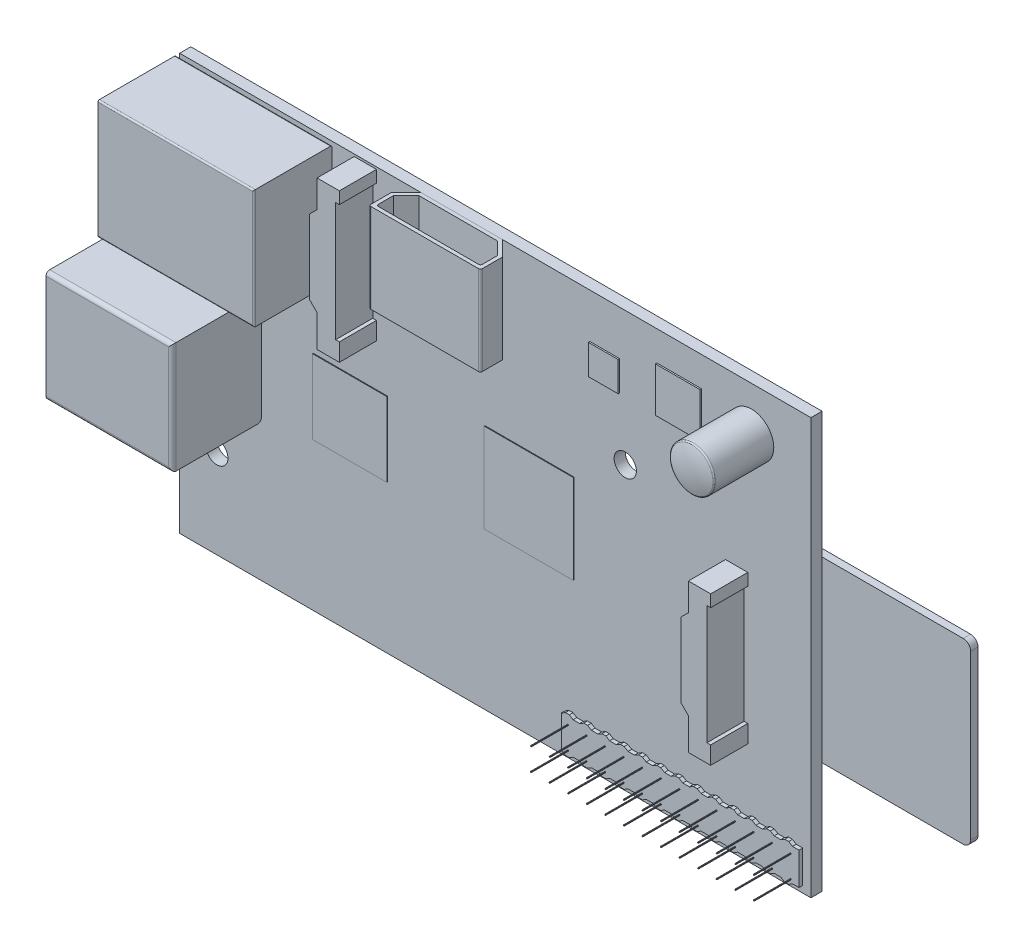
from build123d import *

# Parameters (mm, degrees)
SKETCH1_W              = 85
SKETCH1_H              = 56
BOSS_EXTRUDE1_DEPTH    = 1.5
SKETCH3_W              = 32
SKETCH3_H              = 5
BOSS_EXTRUDE2_DEPTH    = 0.5
CUT_EXTRUDE1_DEPTH     = 0.5
SKETCH5_W              = 0.1
SKETCH5_H              = 0.1
BOSS_EXTRUDE3_DEPTH    = 5
LPATTERN1_COUNT        = 2
LPATTERN1_PITCH        = 3
LPATTERN1_COUNT_DIR2   = 13
LPATTERN1_PITCH_DIR2   = 2.5
SKETCH6_W              = 10
SKETCH6_H              = 10
BOSS_EXTRUDE4_DEPTH    = 13.5
SKETCH7_R              = 4
SKETCH7_R_2            = 1
EXTRUDE_THIN1_DEPTH    = 10
FILLET1_R              = 0.2
SKETCH8_W              = 12
SKETCH8_H              = 10
BOSS_EXTRUDE5_DEPTH    = 8
SKETCH9_R              = 2.5
BOSS_EXTRUDE6_DEPTH    = 6
SKETCH11_W             = 17
SKETCH11_H             = 15
BOSS_EXTRUDE7_DEPTH    = 12
SHELL1_T               = -0.5
FILLET3_R              = 0.5
FILLET4_R              = 0.25
SKETCH13_W             = 2
SKETCH13_H             = 13.8
BOSS_EXTRUDE8_DEPTH    = 16.5
SKETCH14_W             = 1
SKETCH14_H             = 13
BOSS_EXTRUDE9_DEPTH    = 16.5
FILLET5_R              = 0.1
LPATTERN2_COUNT        = 2
LPATTERN2_PITCH        = 6.5
CHAMFER1_SIZE          = 0.1
SKETCH15_W             = 21
SKETCH15_H             = 16
BOSS_EXTRUDE10_DEPTH   = 10.5
CUT_EXTRUDE3_DEPTH     = 20
SKETCH17_R             = 2
CUT_EXTRUDE4_DEPTH     = 6
BOSS_EXTRUDE11_DEPTH   = 5
FILLET7_R              = 0.2
BOSS_EXTRUDE12_DEPTH   = 12
SHELL3_T               = -0.5
SKETCH20_W             = 12
SKETCH20_H             = 0.2
BOSS_EXTRUDE14_DEPTH   = 8
FILLET8_R              = 0.25
LPATTERN3_COUNT        = 2
LPATTERN3_PITCH        = 50
LPATTERN3_COUNT_DIR2   = 2
LPATTERN3_PITCH_DIR2   = 22
SKETCH21_W             = 10
SKETCH21_H             = 10
BOSS_EXTRUDE15_DEPTH   = 0.1
SKETCH21_W_2           = 12
SKETCH21_H_2           = 12
BOSS_EXTRUDE15_2_DEPTH = 0.1
SKETCH22_W             = 4
SKETCH22_H             = 4
BOSS_EXTRUDE16_DEPTH   = 0.2
SKETCH22_W_2           = 6
SKETCH22_H_2           = 6
BOSS_EXTRUDE16_2_DEPTH = 0.2
SKETCH23_R             = 3
BOSS_EXTRUDE17_DEPTH   = 8
DOME1_FACE_RADIUS      = 3
DOME1_HEIGHT           = 0.5
FILLET9_R              = 0.2
BOSS_EXTRUDE18_DEPTH   = 1
WRAP1_START            = -0.2
WRAP1_DEPTH            = 0.2
FILLET10_R             = 1
SKETCH26_W             = 24.304893939
SKETCH26_H             = 23.775245325
CUT_EXTRUDE5_DEPTH     = 31
SKETCH27_R             = 1.5
CUT_EXTRUDE6_DEPTH     = 10


# Read off the part's stored shape, not the designer's step: Wrap1
with BuildPart() as part:
    # Sketch1 → Boss-Extrude1 (new body)
    with BuildSketch(Plane.XY):
        with Locations((42.5, 28)):
            Rectangle(SKETCH1_W, SKETCH1_H)
    extrude(amount=BOSS_EXTRUDE1_DEPTH)


with BuildPart() as body_2:
    # Sketch3 → Boss-Extrude2 (new body)
    with BuildSketch(Plane.XY.offset(1.5)):
        with Locations((67.894973725, 3.074558463)):
            Rectangle(SKETCH3_W, SKETCH3_H)
    extrude(amount=BOSS_EXTRUDE2_DEPTH)

    # Sketch4 → Cut-Extrude1 (cut)
    with BuildSketch(Plane.XY.offset(2)):
        Polygon((83.894973725, 5.574558463), (82.504308399, 5.574558463), (83.018067155, 5.258509186), (83.894973725, 5.258509186), align=None)
        Polygon((81.990441556, 5.574558463), (80.042769937, 5.574558463), (80.556528693, 5.258509186), (81.433435263, 5.258509186), align=None)
        Polygon((79.528903094, 5.574558463), (77.581231476, 5.574558463), (78.094990232, 5.258509186), (78.971896802, 5.258509186), align=None)
        Polygon((77.067364632, 5.574558463), (75.119693014, 5.574558463), (75.63345177, 5.258509186), (76.51035834, 5.258509186), align=None)
        Polygon((74.605826171, 5.574558463), (72.658154553, 5.574558463), (73.171913309, 5.258509186), (74.048819879, 5.258509186), align=None)
        Polygon((72.144287709, 5.574558463), (70.196616091, 5.574558463), (70.710374847, 5.258509186), (71.587281417, 5.258509186), align=None)
        Polygon((51.894973725, 5.574558463), (51.894973725, 5.258509186), (52.451980017, 5.574558463), align=None)
        Polygon((54.913518479, 5.574558463), (52.96584686, 5.574558463), (53.479605617, 5.258509186), (54.356512186, 5.258509186), align=None)
        Polygon((57.37505694, 5.574558463), (55.427385322, 5.574558463), (55.941144078, 5.258509186), (56.818050648, 5.258509186), align=None)
        Polygon((59.836595402, 5.574558463), (57.888923784, 5.574558463), (58.40268254, 5.258509186), (59.27958911, 5.258509186), align=None)
        Polygon((62.298133863, 5.574558463), (60.350462245, 5.574558463), (60.864221001, 5.258509186), (61.741127571, 5.258509186), align=None)
        Polygon((64.759672325, 5.574558463), (62.812000707, 5.574558463), (63.325759463, 5.258509186), (64.202666033, 5.258509186), align=None)
        Polygon((67.221210786, 5.574558463), (65.273539168, 5.574558463), (65.787297924, 5.258509186), (66.664204494, 5.258509186), align=None)
        Polygon((69.682749248, 5.574558463), (67.73507763, 5.574558463), (68.248836386, 5.258509186), (69.125742956, 5.258509186), align=None)
    cut_extrude1 = extrude(amount=-CUT_EXTRUDE1_DEPTH, mode=Mode.SUBTRACT)

    # Mirror2: Cut-Extrude1 across plane
    add(cut_extrude1.mirror(Plane(origin=(0, 3.074558463, 0), x_dir=(0, 0, 1), z_dir=(0, -1, 0))), mode=Mode.SUBTRACT)

    # Sketch5 → Boss-Extrude3 (add)
    with BuildSketch(Plane.XY.offset(2)):
        with Locations((52.802606205, 4.32872358)):
            Rectangle(SKETCH5_W, SKETCH5_H)
    boss_extrude3 = extrude(amount=BOSS_EXTRUDE3_DEPTH)

    # LPattern1: Boss-Extrude3 2 × 13
    with Locations(*[(j * LPATTERN1_PITCH_DIR2, -i * LPATTERN1_PITCH, 0) for i in range(LPATTERN1_COUNT) for j in range(LPATTERN1_COUNT_DIR2) if (i, j) != (0, 0)]):
        add(boss_extrude3)


with BuildPart() as body_3:
    # Sketch6 → Boss-Extrude4 (new body)
    with BuildSketch(Plane.XY.offset(1.5)):
        with Locations((42.667890961, 5.5)):
            Rectangle(SKETCH6_W, SKETCH6_H)
    extrude(amount=BOSS_EXTRUDE4_DEPTH)

    # Sketch7 → Extrude-Thin1 (add)
    with BuildSketch(Plane.XZ.offset(-0.5)):
        with Locations((42.667890961, 10)):
            Circle(SKETCH7_R)
        with Locations((42.667890961, 10)):
            Circle(SKETCH7_R_2, mode=Mode.SUBTRACT)
    extrude(amount=EXTRUDE_THIN1_DEPTH)

    # Fillet1
    fillet1_edges = [body_3.edges().sort_by_distance(p)[0] for p in [
        (38.667890961, 0.5, 10),
        (38.667890961, -9.5, 10),
    ]]
    fillet(fillet1_edges, radius=FILLET1_R)


with BuildPart() as body_4:
    # Sketch8 → Boss-Extrude5 (new body)
    with BuildSketch(Plane.XY.offset(1.5)):
        with Locations((24.989350191, 5.5)):
            Rectangle(SKETCH8_W, SKETCH8_H)
    extrude(amount=BOSS_EXTRUDE5_DEPTH)


with BuildPart() as body_5:
    # Sketch9 → Boss-Extrude6 (new body)
    with BuildSketch(Plane.XZ.offset(-0.5)):
        with Locations(Location((24.989350191, 6.5, 0), (0, 0, 270))):
            Circle(SKETCH9_R)
    extrude(amount=BOSS_EXTRUDE6_DEPTH)

    # Sketch17 → Cut-Extrude4 (cut)
    with BuildSketch(Plane.XZ.offset(5.5)):
        with Locations(Location((24.989350191, 6.5, 0), (0, 0, 270))):
            Circle(SKETCH17_R)
    extrude(amount=-CUT_EXTRUDE4_DEPTH, mode=Mode.SUBTRACT)


with BuildPart() as body_6:
    # Sketch11 → Boss-Extrude7 (new body)
    with BuildSketch(Plane.XY.offset(1.5)):
        with Locations((2.5, 26)):
            Rectangle(SKETCH11_W, SKETCH11_H)
    extrude(amount=BOSS_EXTRUDE7_DEPTH)

    # Shell1
    shell1_openings = [body_6.faces().sort_by_distance(p)[0] for p in [
        (-6, 26, 7.5),
    ]]
    offset(amount=SHELL1_T, openings=shell1_openings, kind=Kind.INTERSECTION)

    # Fillet3
    fillet3_edges = [body_6.edges().sort_by_distance(p)[0] for p in [
        (11, 26, 13.5),
        (2.5, 33.5, 13.5),
        (2.5, 33.5, 1.5),
        (2.5, 18.5, 1.5),
        (2.5, 18.5, 13.5),
    ]]
    fillet(fillet3_edges, radius=FILLET3_R)

    # Fillet4
    fillet4_edges = [body_6.edges().sort_by_distance(p)[0] for p in [
        (2.25, 19, 2),
        (2.25, 33, 2),
        (2.25, 19, 13),
        (2.25, 33, 13),
    ]]
    fillet(fillet4_edges, radius=FILLET4_R)

    # Sketch13 → Boss-Extrude8 (add)
    with BuildSketch(Plane.ZY.offset(6)):
        with Locations((7.5, 26)):
            Rectangle(SKETCH13_W, SKETCH13_H)
    extrude(amount=-BOSS_EXTRUDE8_DEPTH)

    # Sketch14 → Boss-Extrude9 (add)
    with BuildSketch(Plane.ZY.offset(6)):
        with Locations((11, 26)):
            Rectangle(SKETCH14_W, SKETCH14_H)
    boss_extrude9 = extrude(amount=-BOSS_EXTRUDE9_DEPTH)

    # Fillet5
    fillet5_edges = [body_6.edges().sort_by_distance(p)[0] for p in [
        (-6, 26, 6.5),
        (-6, 26, 8.5),
    ]]
    fillet(fillet5_edges, radius=FILLET5_R)

    # LPattern2: Boss-Extrude9 ×2
    with Locations(*[(0, 0, -i * LPATTERN2_PITCH) for i in range(1, LPATTERN2_COUNT)]):
        add(boss_extrude9)

    # Chamfer1
    chamfer1_edges = [body_6.edges().sort_by_distance(p)[0] for p in [
        (-6, 19.5, 4.5),
        (-6, 32.5, 4.5),
        (-6, 19.5, 11),
        (-6, 32.5, 11),
    ]]
    chamfer(chamfer1_edges, length=CHAMFER1_SIZE)


with BuildPart() as body_7:
    # Sketch15 → Boss-Extrude10 (new body)
    with BuildSketch(Plane.XY.offset(1.5)):
        with Locations((10, 47.5)):
            Rectangle(SKETCH15_W, SKETCH15_H)
    extrude(amount=BOSS_EXTRUDE10_DEPTH)

    # Sketch16 → Cut-Extrude3 (cut)
    with BuildSketch(Plane.ZY.offset(0.5)):
        Polygon((11.2, 54.7), (4.2, 54.7), (4.2, 50.697953924), (3.2, 50.697953924), (3.2, 49.697953924), (1.637903555, 49.697953924), (1.637903555, 45.302046076), (3.2, 45.302046076), (3.2, 44.302046076), (4.2, 44.302046076), (4.2, 40.3), (11.2, 40.3), align=None)
    extrude(amount=-CUT_EXTRUDE3_DEPTH, mode=Mode.SUBTRACT)

    # Fillet7
    fillet7_edges = [body_7.edges().sort_by_distance(p)[0] for p in [
        (20.5, 47.5, 12),
        (10, 55.5, 12),
        (10, 55.5, 1.5),
        (10, 39.5, 1.5),
        (10, 39.5, 12),
    ]]
    fillet(fillet7_edges, radius=FILLET7_R)


with BuildPart() as body_8:
    # Sketch18 → Boss-Extrude11 (new body)
    with BuildSketch(Plane.XY.offset(1.5)):
        Polygon((23.5, 52), (22.5, 51), (22.5, 41), (23.5, 40), (23.5, 35.7), (26.5, 35.7), (26.5, 38.08552574), (26, 38.08552574), (26, 54.08552574), (26.5, 54.08552574), (26.5, 55.7), (23.5, 55.7), align=None)
    boss_extrude11 = extrude(amount=BOSS_EXTRUDE11_DEPTH)


with BuildPart() as body_9:
    # Sketch19 → Boss-Extrude12 (new body)
    with BuildSketch(Plane(origin=(0, 56, 0), x_dir=(1, 0, 0), z_dir=(0, 1, 0))):
        Polygon((45.5, -6.5), (30.5, -6.5), (30.5, -3.5), (32.5, -1.5), (43.5, -1.5), (45.5, -3.5), align=None)
    extrude(amount=-BOSS_EXTRUDE12_DEPTH)

    # Shell3
    shell3_openings = [body_9.faces().sort_by_distance(p)[0] for p in [
        (38, 56, 4.103286385),
    ]]
    offset(amount=SHELL3_T, openings=shell3_openings, kind=Kind.INTERSECTION)

    # Sketch20 → Boss-Extrude14 (add)
    with BuildSketch(Plane(origin=(0, 44.5, 0), x_dir=(1, 0, 0), z_dir=(0, 1, 0))):
        with Locations((38, -3.9)):
            Rectangle(SKETCH20_W, SKETCH20_H)
    extrude(amount=BOSS_EXTRUDE14_DEPTH)

    # Fillet8
    fillet8_edges = [body_9.edges().sort_by_distance(p)[0] for p in [
        (45.5, 50, 6.5),
        (30.5, 50, 6.5),
        (45, 50.25, 6),
        (31, 50.25, 6),
    ]]
    fillet(fillet8_edges, radius=FILLET8_R)


with BuildPart() as part_1:
    add(part.part)

    # LPattern3: Boss-Extrude11 2 × 2, 2 skipped
    with Locations(*[(i * LPATTERN3_PITCH, -j * LPATTERN3_PITCH_DIR2, 0) for i in range(LPATTERN3_COUNT) for j in range(LPATTERN3_COUNT_DIR2) if (i, j) not in ((0, 0), (0, 1), (1, 0))]):
        add(boss_extrude11)

    # Sketch27 → Cut-Extrude6 (cut)
    with BuildSketch(Plane.XY.offset(1.5)):
        with Locations((60, 38)):
            Circle(SKETCH27_R)
        with Locations((5, 12)):
            Circle(SKETCH27_R)
    extrude(amount=-CUT_EXTRUDE6_DEPTH, mode=Mode.SUBTRACT)


with BuildPart() as body_10:
    # Sketch21 → Boss-Extrude15 (new body)
    with BuildSketch(Plane.XY.offset(1.5)):
        with Locations((23, 25)):
            Rectangle(SKETCH21_W, SKETCH21_H)
    extrude(amount=BOSS_EXTRUDE15_DEPTH)


with BuildPart() as body_11:
    # Sketch21 → Boss-Extrude15 2 (new body)
    with BuildSketch(Plane.XY.offset(1.5)):
        with Locations((47.107501829, 27.116628368)):
            Rectangle(SKETCH21_W_2, SKETCH21_H_2)
    extrude(amount=BOSS_EXTRUDE15_2_DEPTH)


with BuildPart() as body_12:
    # Sketch22 → Boss-Extrude16 (new body)
    with BuildSketch(Plane.XY.offset(1.5)):
        with Locations((57.25, 48)):
            Rectangle(SKETCH22_W, SKETCH22_H)
    extrude(amount=BOSS_EXTRUDE16_DEPTH)


with BuildPart() as body_13:
    # Sketch22 → Boss-Extrude16 2 (new body)
    with BuildSketch(Plane.XY.offset(1.5)):
        with Locations((67.25, 49)):
            Rectangle(SKETCH22_W_2, SKETCH22_H_2)
    extrude(amount=BOSS_EXTRUDE16_2_DEPTH)


with BuildPart() as body_14:
    # Sketch23 → Boss-Extrude17 (new body)
    with BuildSketch(Plane.XY.offset(1.5)):
        with Locations((77, 50)):
            Circle(SKETCH23_R)
    extrude(amount=BOSS_EXTRUDE17_DEPTH)

    # Dome1: a dome of height H over a round flat face of radius A is a cap of a sphere of radius (A * A + H * H) / (2 * H)
    dome1_r = (DOME1_FACE_RADIUS * DOME1_FACE_RADIUS + DOME1_HEIGHT * DOME1_HEIGHT) / (2 * DOME1_HEIGHT)
    dome1_base = Plane((77, 50, 9.5), z_dir=(0, 0, 1))
    with Locations(dome1_base.offset(DOME1_HEIGHT - dome1_r)):
        dome1_ball = Sphere(dome1_r, mode=Mode.PRIVATE)
    add(split(dome1_ball, bisect_by=dome1_base, keep=Keep.TOP, mode=Mode.PRIVATE))

    # Fillet9
    fillet9_edges = [body_14.edges().sort_by_distance(p)[0] for p in [
        (74, 50, 9.5),
    ]]
    fillet(fillet9_edges, radius=FILLET9_R)


with BuildPart() as body_15:
    # Sketch24 → Boss-Extrude18 (new body)
    with BuildSketch(Plane(origin=(0, 0, 0), x_dir=(-1, 0, 0), z_dir=(0, 0, -1))):
        Polygon((-73.642978125, 15), (-105, 15), (-105, 39), (-70, 39), (-70, 18.642978125), align=None)
    extrude(amount=BOSS_EXTRUDE18_DEPTH)

    # Wrap1 outline → Wrap1 (cut)
    # profile 1 of 4: a face of its own
    with BuildSketch(Plane(origin=(0, 0, -1), x_dir=(-1, 0, 0), z_dir=(0, 0, -1)).offset(WRAP1_START)):
        with BuildLine():
            add(Edge.make_bspline(
                [(-97.099984972, 19.704636475), (-97.099910305, 19.678525069), (-97.099766943, 19.62839032), (-97.096542146, 19.556085612), (-97.091273316, 19.489806079), (-97.083222568, 19.429667638), (-97.073976835, 19.375446348), (-97.062457247, 19.327199246), (-97.047933819, 19.285021981), (-97.028085519, 19.23734358), (-96.993540547, 19.187438021), (-96.935887295, 19.146201074), (-96.866742985, 19.119130925), (-96.815985111, 19.117103867), (-96.789067251, 19.11602888)],
                knots=[0, 0, 0, 0, 0.103577828, 0.198872802, 0.287057146, 0.36725271, 0.439492683, 0.505211235, 0.563769695, 0.616246184, 0.71001282, 0.799777886, 0.89381843, 1, 1, 1, 1], degree=3))
            Line((-97.099984972, 19.704636475), (-97.099984972, 20.078054196))
            Line((-97.099984972, 20.078054196), (-97.606314086, 20.078054196))
            Line((-97.606314086, 20.078054196), (-97.606314086, 18.660332677))
            Line((-97.606314086, 18.660332677), (-97.099984972, 18.660332677))
            Line((-97.099984972, 18.660332677), (-97.099984972, 18.806693437))
            add(Edge.make_bspline(
                [(-96.661693833, 18.609699766), (-96.682569177, 18.610268806), (-96.723749914, 18.611391351), (-96.784110146, 18.621469921), (-96.842334794, 18.636184305), (-96.898250514, 18.657944328), (-96.952265725, 18.685883536), (-97.004530951, 18.719680102), (-97.053804717, 18.760666258), (-97.084394151, 18.791154295), (-97.099984972, 18.806693437)],
                knots=[0, 0, 0, 0, 0.126464108, 0.249475423, 0.370073488, 0.490023371, 0.612294809, 0.738232318, 0.866582257, 1, 1, 1, 1], degree=3))
            add(Edge.make_bspline(
                [(-95.93542801, 19.566187108), (-95.936024529, 19.532411338), (-95.93719207, 19.466303468), (-95.946678778, 19.36919163), (-95.963331417, 19.276660971), (-95.986157757, 19.188507108), (-96.015642921, 19.10491992), (-96.051131553, 19.025660923), (-96.093370254, 18.95062494), (-96.141863652, 18.880957774), (-96.195548847, 18.817785651), (-96.252404943, 18.762309837), (-96.312150955, 18.714610762), (-96.376028094, 18.676728022), (-96.442718976, 18.646149937), (-96.51295212, 18.624833705), (-96.5863035, 18.611704651), (-96.636321855, 18.610374493), (-96.661693833, 18.609699766)],
                knots=[0, 0, 0, 0, 0.075798931, 0.148358008, 0.218715806, 0.286620861, 0.352515017, 0.417420846, 0.481292903, 0.545493213, 0.607638867, 0.667075962, 0.723557301, 0.778777834, 0.833347415, 0.887830258, 0.943101523, 1, 1, 1, 1], degree=3))
            add(Edge.make_bspline(
                [(-96.524826744, 20.891345336), (-96.477887069, 20.834468788), (-96.386832552, 20.72413853), (-96.267054918, 20.553159526), (-96.165070381, 20.384466054), (-96.081401738, 20.217479026), (-96.016559798, 20.051979027), (-95.970523398, 19.888515167), (-95.941218381, 19.726781796), (-95.93734343, 19.619310859), (-95.93542801, 19.566187108)],
                knots=[0, 0, 0, 0, 0.149409612, 0.289827739, 0.422642351, 0.548605415, 0.667905425, 0.782285286, 0.892381861, 1, 1, 1, 1], degree=3))
            Line((-96.524826744, 20.891345336), (-96.785111554, 21.195933943))
            add(Edge.make_bspline(
                [(-97.099984972, 21.91824407), (-97.099263456, 21.890508264), (-97.097806134, 21.834487376), (-97.08444622, 21.74995042), (-97.062773097, 21.664620448), (-97.033517837, 21.576702933), (-96.991582007, 21.486558501), (-96.93616279, 21.3927901), (-96.867012765, 21.294461375), (-96.813290604, 21.229833435), (-96.785111554, 21.195933943)],
                knots=[0, 0, 0, 0, 0.103217746, 0.208479606, 0.31779, 0.430816732, 0.552957457, 0.687178245, 0.835914644, 1, 1, 1, 1], degree=3))
            add(Edge.make_bspline(
                [(-96.8626432, 22.204636475), (-96.881198823, 22.203778796), (-96.916479216, 22.202148065), (-96.965860998, 22.188463542), (-97.008240209, 22.166263748), (-97.042743058, 22.133982687), (-97.069322982, 22.092431386), (-97.086735635, 22.04170859), (-97.09801307, 21.982818603), (-97.099298607, 21.940720682), (-97.099984972, 21.91824407)],
                knots=[0, 0, 0, 0, 0.130772075, 0.248641082, 0.358570943, 0.465253919, 0.578322157, 0.703157386, 0.841511979, 1, 1, 1, 1], degree=3))
            add(Edge.make_bspline(
                [(-96.593655858, 21.742611158), (-96.594322873, 21.780617084), (-96.595563504, 21.851307216), (-96.606680604, 21.949056358), (-96.626445282, 22.030073221), (-96.654924756, 22.094835335), (-96.692276904, 22.145368255), (-96.740589402, 22.180428748), (-96.798881292, 22.200886485), (-96.840582755, 22.203339047), (-96.8626432, 22.204636475)],
                knots=[0, 0, 0, 0, 0.188217165, 0.350079523, 0.486314825, 0.599720386, 0.698480414, 0.793847541, 0.890943518, 1, 1, 1, 1], degree=3))
            Line((-96.593655858, 21.742611158), (-96.593655858, 21.445142804))
            Line((-96.593655858, 21.445142804), (-96.087326744, 21.445142804))
            Line((-96.087326744, 21.445142804), (-96.087326744, 22.660332677))
            Line((-96.087326744, 22.660332677), (-96.593655858, 22.660332677))
            Line((-96.593655858, 22.660332677), (-96.593655858, 22.531376981))
            add(Edge.make_bspline(
                [(-97.00900396, 22.710965589), (-96.989468466, 22.710233829), (-96.951032054, 22.708794079), (-96.894156351, 22.70106297), (-96.839362972, 22.686505672), (-96.786103395, 22.666635343), (-96.734556256, 22.641381225), (-96.685260317, 22.610002604), (-96.637492012, 22.573853209), (-96.608408736, 22.545672182), (-96.593655858, 22.531376981)],
                knots=[0, 0, 0, 0, 0.126084722, 0.248073816, 0.369396688, 0.491065023, 0.614328805, 0.738947174, 0.867577483, 1, 1, 1, 1], degree=3))
            add(Edge.make_bspline(
                [(-97.656946997, 21.825680779), (-97.656215021, 21.857339546), (-97.654779311, 21.91943555), (-97.647195506, 22.01043778), (-97.633027555, 22.097246556), (-97.612189307, 22.179308865), (-97.587146144, 22.257259499), (-97.556165499, 22.330741147), (-97.518883095, 22.399481937), (-97.476546106, 22.463570751), (-97.429002128, 22.520746852), (-97.379348821, 22.572394546), (-97.325266534, 22.614912743), (-97.268521357, 22.650594982), (-97.208002211, 22.67757656), (-97.14434882, 22.696231683), (-97.077804024, 22.708917772), (-97.032271457, 22.710273037), (-97.00900396, 22.710965589)],
                knots=[0, 0, 0, 0, 0.077644879, 0.152293886, 0.223736827, 0.293061565, 0.359729377, 0.424349007, 0.48829531, 0.551249679, 0.612356802, 0.670432256, 0.726585662, 0.780601957, 0.834443774, 0.888456198, 0.943000245, 1, 1, 1, 1], degree=3))
            add(Edge.make_bspline(
                [(-97.097611554, 20.61602888), (-97.124582735, 20.648139915), (-97.176877038, 20.710399857), (-97.251461957, 20.80162019), (-97.317740123, 20.889220242), (-97.378327863, 20.970844058), (-97.430302729, 21.048954115), (-97.476772211, 21.121136922), (-97.514566137, 21.189683352), (-97.557749177, 21.274310273), (-97.598270754, 21.383445764), (-97.632192048, 21.521753928), (-97.652988508, 21.670254174), (-97.655601963, 21.772869191), (-97.656946997, 21.825680779)],
                knots=[0, 0, 0, 0, 0.091930007, 0.17824268, 0.258254189, 0.332718713, 0.401022182, 0.463893955, 0.520829819, 0.572536307, 0.672066261, 0.775119899, 0.884263772, 1, 1, 1, 1], degree=3))
            add(Edge.make_bspline(
                [(-96.492390035, 19.499731412), (-96.493329464, 19.525335002), (-96.49524423, 19.577520863), (-96.505496761, 19.657648303), (-96.525313919, 19.740358784), (-96.550169773, 19.825114445), (-96.579333122, 19.907967085), (-96.61244432, 19.984995644), (-96.64874447, 20.054024637), (-96.683102259, 20.107659005), (-96.715059564, 20.152411445), (-96.747119799, 20.193519528), (-96.786657535, 20.243378446), (-96.83398425, 20.301565033), (-96.888786842, 20.3683267), (-96.951355582, 20.443429485), (-97.021523297, 20.527234834), (-97.071442662, 20.585490109), (-97.097611554, 20.61602888)],
                knots=[0, 0, 0, 0, 0.059070014, 0.120397937, 0.185901791, 0.254989078, 0.324044237, 0.388328407, 0.448179067, 0.503685285, 0.535074919, 0.5749733, 0.62388781, 0.681826195, 0.747937047, 0.823078876, 0.90725383, 1, 1, 1, 1], degree=3))
            add(Edge.make_bspline(
                [(-96.789067251, 19.11602888), (-96.767798114, 19.117088898), (-96.726366222, 19.119153795), (-96.667948725, 19.13989432), (-96.616307448, 19.173642903), (-96.57226061, 19.220199942), (-96.535786915, 19.276957043), (-96.510660525, 19.343841469), (-96.494322797, 19.418772887), (-96.493053352, 19.471946767), (-96.492390035, 19.499731412)],
                knots=[0, 0, 0, 0, 0.117004761, 0.227923149, 0.337313013, 0.454643139, 0.578984121, 0.707083689, 0.846944107, 1, 1, 1, 1], degree=3))
        make_face()
    # profile 2 of 4: a face of its own
    with BuildSketch(Plane(origin=(0, 0, -1), x_dir=(-1, 0, 0), z_dir=(0, 0, -1)).offset(WRAP1_START)):
        with BuildLine():
            add(Edge.make_bspline(
                [(-94.591282441, 18.609699766), (-94.630187677, 18.611105026), (-94.706125094, 18.613847891), (-94.815658867, 18.638632642), (-94.91795219, 18.677107158), (-95.01115618, 18.733786782), (-95.097294367, 18.80502244), (-95.173702651, 18.893576023), (-95.244019368, 18.996158308), (-95.304353185, 19.115536132), (-95.358208962, 19.250036096), (-95.404240293, 19.400747705), (-95.443914422, 19.567426299), (-95.474565416, 19.750455225), (-95.49999199, 19.949416863), (-95.517959359, 20.164534412), (-95.527843313, 20.395998358), (-95.52950526, 20.555629255), (-95.530364719, 20.638180779)],
                knots=[0, 0, 0, 0, 0.047035507, 0.091806534, 0.135261921, 0.178786435, 0.223215863, 0.270034205, 0.31988445, 0.373425981, 0.43157961, 0.495090661, 0.564003299, 0.638843204, 0.719618901, 0.806759781, 0.900067752, 1, 1, 1, 1], degree=3))
            add(Edge.make_bspline(
                [(-93.656946997, 20.638180779), (-93.657848333, 20.556423778), (-93.659596495, 20.397854135), (-93.668963721, 20.167902672), (-93.688562725, 19.953705493), (-93.713146105, 19.755359889), (-93.745110609, 19.572696126), (-93.785492175, 19.40600596), (-93.832359508, 19.254819146), (-93.886588527, 19.119144885), (-93.949231783, 19.000048075), (-94.01812268, 18.895635889), (-94.09482847, 18.807039867), (-94.179737935, 18.734405803), (-94.272363611, 18.678568684), (-94.372150579, 18.638334258), (-94.479358456, 18.613989263), (-94.5534437, 18.611149939), (-94.591282441, 18.609699766)],
                knots=[0, 0, 0, 0, 0.099336792, 0.192666065, 0.279515042, 0.36058627, 0.435439871, 0.50467955, 0.568824317, 0.62760782, 0.68192571, 0.732044441, 0.779274863, 0.823827691, 0.86723681, 0.910074608, 0.954070967, 1, 1, 1, 1], degree=3))
            add(Edge.make_bspline(
                [(-94.591282441, 22.710965589), (-94.555012501, 22.709564398), (-94.483711491, 22.706809878), (-94.380072327, 22.681394483), (-94.28352381, 22.639471513), (-94.192335475, 22.582700433), (-94.109261668, 22.507699386), (-94.031911171, 22.417295267), (-93.96186705, 22.310316921), (-93.897778088, 22.187920035), (-93.841042765, 22.049304063), (-93.79143909, 21.894824112), (-93.750126205, 21.724148888), (-93.715359608, 21.537998545), (-93.688811405, 21.335690351), (-93.670192067, 21.11737808), (-93.659252692, 20.88301893), (-93.657731878, 20.721526003), (-93.656946997, 20.638180779)],
                knots=[0, 0, 0, 0, 0.043474371, 0.08546379, 0.127145547, 0.169382329, 0.213774379, 0.260906833, 0.311818325, 0.366888351, 0.426485877, 0.491342224, 0.561424391, 0.637091784, 0.71851074, 0.80619138, 0.899976902, 1, 1, 1, 1], degree=3))
            add(Edge.make_bspline(
                [(-95.530364719, 20.638180779), (-95.530148662, 20.694093496), (-95.529725607, 20.803574714), (-95.523846743, 20.964207629), (-95.515302642, 21.117998582), (-95.503493161, 21.264671617), (-95.488776417, 21.404575919), (-95.469480041, 21.537472658), (-95.447999306, 21.663788016), (-95.421413754, 21.782926338), (-95.392734477, 21.895009282), (-95.359689845, 21.999792942), (-95.325799848, 22.098036925), (-95.286637677, 22.188439405), (-95.244864271, 22.271792905), (-95.199765328, 22.348009727), (-95.151499713, 22.41716175), (-95.099966235, 22.479161104), (-95.045595323, 22.533961743), (-94.987917276, 22.580790178), (-94.928859589, 22.621660274), (-94.866359755, 22.6543906), (-94.801305681, 22.679665162), (-94.733758632, 22.698195347), (-94.663319717, 22.708365332), (-94.615574403, 22.710088746), (-94.591282441, 22.710965589)],
                knots=[0, 0, 0, 0, 0.06702541, 0.13124069, 0.192671046, 0.251664648, 0.307629196, 0.361280532, 0.412632207, 0.461187777, 0.507579079, 0.551276702, 0.59287331, 0.632101869, 0.669286046, 0.704582448, 0.738174092, 0.770273171, 0.801122689, 0.830551219, 0.859224583, 0.88708291, 0.914910724, 0.942749311, 0.970871873, 1, 1, 1, 1], degree=3))
        make_face()
        with BuildLine():
            add(Edge.make_bspline(
                [(-94.590491301, 19.166661791), (-94.575339579, 19.167519943), (-94.545640897, 19.169201994), (-94.503272857, 19.18420746), (-94.465202739, 19.208884417), (-94.430794926, 19.24279013), (-94.400861893, 19.2866118), (-94.373966982, 19.339203654), (-94.351295009, 19.401440109), (-94.33242569, 19.474370527), (-94.315807275, 19.560231091), (-94.302006835, 19.661670151), (-94.290317232, 19.779634852), (-94.281292542, 19.9142178), (-94.273216353, 20.065326935), (-94.267948354, 20.233085355), (-94.264762706, 20.417440031), (-94.264617607, 20.545879719), (-94.264541934, 20.612864323)],
                knots=[0, 0, 0, 0, 0.028747528, 0.056347633, 0.084314459, 0.114463034, 0.147581946, 0.184820037, 0.226559101, 0.273277998, 0.32796999, 0.392802829, 0.467914725, 0.553394038, 0.649325397, 0.755716494, 0.872599863, 1, 1, 1, 1], degree=3))
            add(Edge.make_bspline(
                [(-94.922769782, 20.617611158), (-94.922832066, 20.550096), (-94.922951294, 20.420854152), (-94.917980328, 20.235488437), (-94.914456095, 20.066887216), (-94.90579238, 19.915028811), (-94.897499282, 19.779816272), (-94.883922542, 19.661809166), (-94.871817546, 19.56014501), (-94.854725602, 19.474418385), (-94.836310135, 19.401227231), (-94.812311854, 19.339412207), (-94.785820915, 19.286329662), (-94.754846889, 19.242791698), (-94.719633321, 19.20854901), (-94.68017242, 19.184404199), (-94.636675511, 19.169077638), (-94.606179776, 19.167482439), (-94.590491301, 19.166661791)],
                knots=[0, 0, 0, 0, 0.127619969, 0.244298333, 0.350523445, 0.446367424, 0.531822567, 0.606527834, 0.670897645, 0.725255997, 0.771689893, 0.81335068, 0.850361607, 0.883567875, 0.913891158, 0.942532814, 0.970436113, 1, 1, 1, 1], degree=3))
            add(Edge.make_bspline(
                [(-94.590491301, 22.154003563), (-94.607237723, 22.152943318), (-94.639943083, 22.150872684), (-94.686575084, 22.134334443), (-94.728038665, 22.106506786), (-94.76370002, 22.067137152), (-94.795689046, 22.018132767), (-94.822082641, 21.958135073), (-94.843967349, 21.8877186), (-94.861978321, 21.805889772), (-94.876609874, 21.710984288), (-94.889198852, 21.601193525), (-94.898954051, 21.475818206), (-94.907627027, 21.334449296), (-94.914819621, 21.177528223), (-94.919119388, 21.004760025), (-94.922610574, 20.816464919), (-94.922715307, 20.685651085), (-94.922769782, 20.617611158)],
                knots=[0, 0, 0, 0, 0.029988866, 0.058567536, 0.087566045, 0.118693877, 0.153204413, 0.192162888, 0.235852549, 0.285320594, 0.342332859, 0.408058333, 0.483532612, 0.567905473, 0.66214907, 0.765324432, 0.877938685, 1, 1, 1, 1], degree=3))
            add(Edge.make_bspline(
                [(-94.264541934, 20.612864323), (-94.26462587, 20.685913906), (-94.264786782, 20.825955454), (-94.267854421, 21.026399252), (-94.273436751, 21.208108071), (-94.280555527, 21.370829207), (-94.288503979, 21.515207739), (-94.300459453, 21.640491822), (-94.313722728, 21.747108331), (-94.32826722, 21.836580614), (-94.346594731, 21.911754205), (-94.368276461, 21.976044454), (-94.395457102, 22.029949189), (-94.424989457, 22.075603345), (-94.460593709, 22.110424465), (-94.500127998, 22.135586285), (-94.543949085, 22.151661671), (-94.574795563, 22.153213792), (-94.590491301, 22.154003563)],
                knots=[0, 0, 0, 0, 0.13088471, 0.250915836, 0.359169998, 0.456598859, 0.542751676, 0.618213534, 0.682036687, 0.735247536, 0.780514393, 0.82056319, 0.856485995, 0.888463094, 0.917532707, 0.944929843, 0.971978428, 1, 1, 1, 1], degree=3))
        make_face(mode=Mode.SUBTRACT)
    # profile 3 of 4: a face of its own
    with BuildSketch(Plane(origin=(0, 0, -1), x_dir=(-1, 0, 0), z_dir=(0, 0, -1)).offset(WRAP1_START)):
        with BuildLine():
            add(Edge.make_bspline(
                [(-92.177516618, 20.194351665), (-92.189542166, 20.238085776), (-92.214761031, 20.329800897), (-92.250986232, 20.474325538), (-92.287184973, 20.632473614), (-92.311307256, 20.742328044), (-92.323877377, 20.799573184)],
                knots=[0, 0, 0, 0, 0.218491265, 0.458199607, 0.717667837, 1, 1, 1, 1], degree=3))
            Line((-92.177516618, 20.194351665), (-91.744763453, 18.660332677))
            Line((-91.744763453, 18.660332677), (-91.277200162, 18.660332677))
            Line((-91.277200162, 18.660332677), (-91.277200162, 22.154003563))
            Line((-91.277200162, 22.154003563), (-90.973402694, 22.154003563))
            Line((-90.973402694, 22.154003563), (-90.973402694, 22.660332677))
            Line((-90.973402694, 22.660332677), (-92.087326744, 22.660332677))
            Line((-92.087326744, 22.660332677), (-92.087326744, 22.154003563))
            Line((-92.087326744, 22.154003563), (-91.783529276, 22.154003563))
            Line((-91.783529276, 22.154003563), (-91.783529276, 21.235490905))
            Line((-91.783529276, 21.235490905), (-91.719446997, 20.040870652))
            Line((-91.719446997, 20.040870652), (-91.736060922, 20.040870652))
            Line((-91.736060922, 20.040870652), (-91.979731808, 21.208592171))
            Line((-91.979731808, 21.208592171), (-92.379257124, 22.660332677))
            Line((-92.379257124, 22.660332677), (-93.302516618, 22.660332677))
            Line((-93.302516618, 22.660332677), (-93.302516618, 22.154003563))
            Line((-93.302516618, 22.154003563), (-92.998719149, 22.154003563))
            Line((-92.998719149, 22.154003563), (-92.998719149, 19.166661791))
            Line((-92.998719149, 19.166661791), (-93.302516618, 19.166661791))
            Line((-93.302516618, 19.166661791), (-93.302516618, 18.660332677))
            Line((-93.302516618, 18.660332677), (-92.188592567, 18.660332677))
            Line((-92.188592567, 18.660332677), (-92.188592567, 19.166661791))
            Line((-92.188592567, 19.166661791), (-92.492390035, 19.166661791))
            Line((-92.492390035, 19.166661791), (-92.492390035, 20.491820019))
            Line((-92.492390035, 20.491820019), (-92.536693833, 21.6990985))
            Line((-92.536693833, 21.6990985), (-92.520079909, 21.6990985))
            Line((-92.520079909, 21.6990985), (-92.323877377, 20.799573184))
        make_face()
    # profile 4 of 4: a face of its own
    with BuildSketch(Plane(origin=(0, 0, -1), x_dir=(-1, 0, 0), z_dir=(0, 0, -1)).offset(WRAP1_START)):
        Polygon((-89.656946997, 22.660332677), (-90.770871048, 22.660332677), (-90.770871048, 22.154003563), (-90.505839403, 22.154003563), (-89.859478643, 20.419826348), (-89.859478643, 19.166661791), (-90.163276111, 19.166661791), (-90.163276111, 18.660332677), (-88.998719149, 18.660332677), (-88.998719149, 19.166661791), (-89.302516618, 19.166661791), (-89.302516618, 20.467294703), (-88.69571282, 22.154003563), (-88.441757124, 22.154003563), (-88.441757124, 22.660332677), (-89.454415352, 22.660332677), (-89.454415352, 22.154003563), (-89.215491301, 22.154003563), (-89.559636871, 21.169035209), (-89.569921681, 21.169035209), (-89.936219149, 22.154003563), (-89.656946997, 22.154003563), align=None)
    extrude(amount=WRAP1_DEPTH, mode=Mode.SUBTRACT)

    # Fillet10
    fillet10_edges = [body_15.edges().sort_by_distance(p)[0] for p in [
        (105, 39, -0.5),
        (70, 39, -0.5),
        (105, 15, -0.5),
    ]]
    fillet(fillet10_edges, radius=FILLET10_R)


with BuildPart() as cut_extrude5_tool:
    # Sketch26 → Cut-Extrude5 (new body)
    with BuildSketch(Plane.ZY.offset(-18.989350191)):
        with Locations((13.65244697, -0.903986506)):
            Rectangle(SKETCH26_W, SKETCH26_H)
    extrude(amount=-CUT_EXTRUDE5_DEPTH)


with BuildPart() as body_3_1:
    add(body_3.part)

    # Cut-Extrude5: cut by cut_extrude5_tool
    add(cut_extrude5_tool.part, mode=Mode.SUBTRACT)


with BuildPart() as body_4_1:
    add(body_4.part)

    # Cut-Extrude5: cut by cut_extrude5_tool
    add(cut_extrude5_tool.part, mode=Mode.SUBTRACT)


with BuildPart() as body_5_1:
    add(body_5.part)

    # Cut-Extrude5: cut by cut_extrude5_tool
    add(cut_extrude5_tool.part, mode=Mode.SUBTRACT)


solid = Compound([body_2.part, body_6.part, body_7.part, body_8.part, body_9.part, part_1.part, body_10.part, body_11.part, body_12.part, body_13.part, body_14.part, body_15.part])
